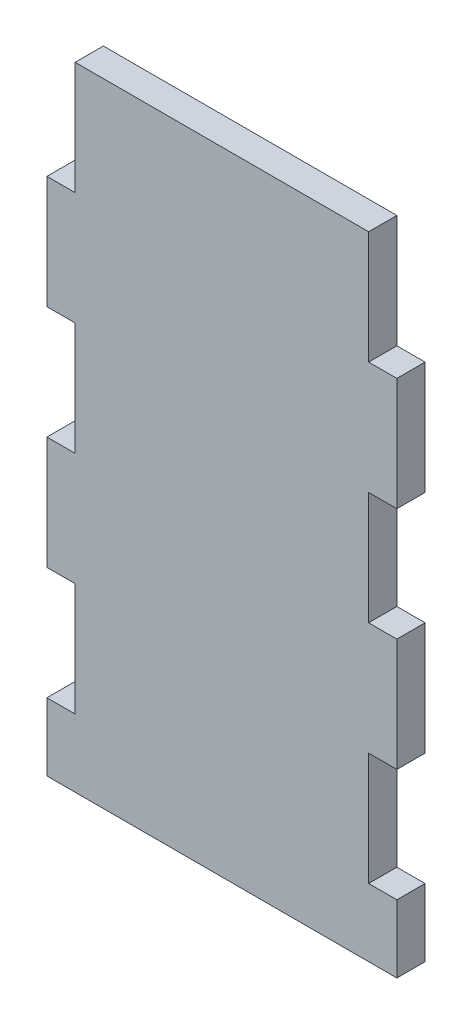
from build123d import *

# Parameters (mm, degrees)
BOSS_EXTRUDE1_DEPTH = 6.35


with BuildPart() as part:
    # Sketch1 → Boss-Extrude1 (new body)
    with BuildSketch(Plane.XY):
        Polygon((-39.37, 20.32), (-33.02, 20.32), (-33.02, -5.08), (-39.37, -5.08), (-39.37, -30.48), (-33.02, -30.48), (-33.02, -55.88), (-39.37, -55.88), (-39.37, -71.12), (39.37, -71.12), (39.37, -55.88), (33.02, -55.88), (33.02, -30.48), (39.37, -30.48), (39.37, -5.08), (33.02, -5.08), (33.02, 20.32), (39.37, 20.32), (39.37, 45.72), (33.02, 45.72), (33.02, 71.12), (-33.02, 71.12), (-33.02, 45.72), (-39.37, 45.72), align=None)
    extrude(amount=BOSS_EXTRUDE1_DEPTH)


solid = part.part
